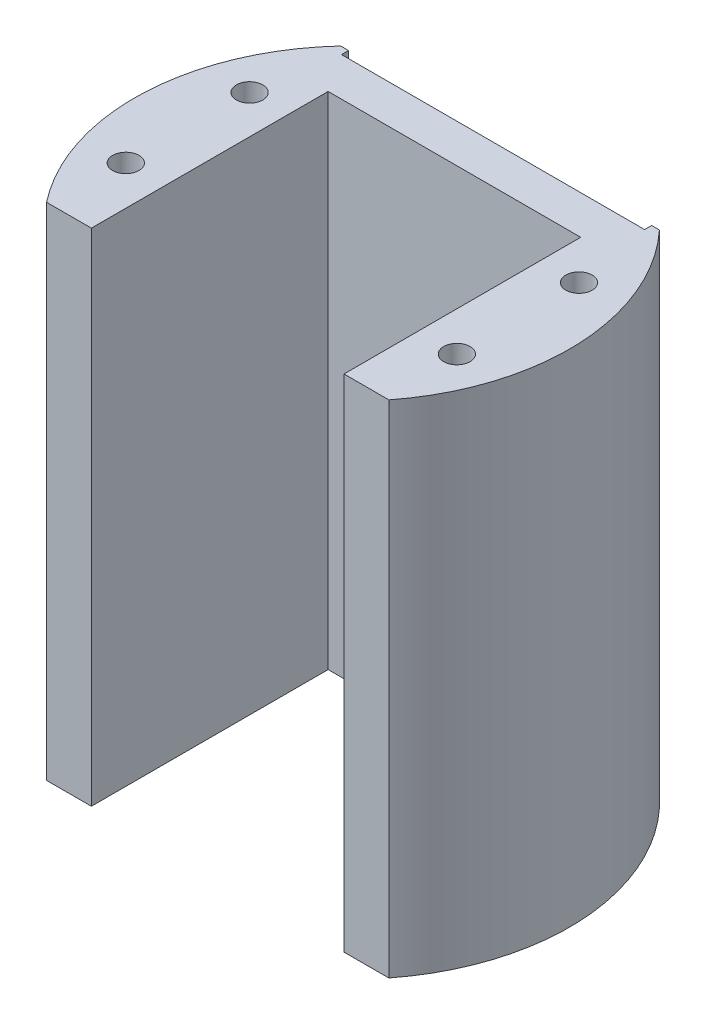
from build123d import *

# Parameters (mm, degrees)
SKETCH1_R           = 3
BOSS_EXTRUDE2_DEPTH = 114


with BuildPart() as part:
    # Sketch1 → Boss-Extrude2 (new body)
    with BuildSketch(Plane(origin=(0, 0, 0), x_dir=(1, 0, 0), z_dir=(0, 1, 0))):
        with BuildLine():
            Line((-38.960872846, -30.582205399), (-28.757656934, -30.582205399))
            Line((-28.757656934, -30.582205399), (-28.757656934, 23.321119009))
            Line((-28.757656934, 23.321119009), (28.757656934, 23.321119009))
            Line((28.757656934, 23.321119009), (28.757656934, -30.582205399))
            Line((28.757656934, -30.582205399), (38.960872846, -30.582205399))
            ThreePointArc((38.960872846, -30.582205399), (46.813208243, -16.178517669), (49.53, 0))
            ThreePointArc((49.53, 0), (46.099349035, 18.112728082), (36.282638054, 33.716332479))
            Line((36.282638054, 33.716332479), (34.5, 33.716332479))
            Line((34.5, 33.716332479), (34.5, 32.116332479))
            Line((34.5, 32.116332479), (-34.5, 32.116332479))
            Line((-34.5, 32.116332479), (-34.5, 33.716332479))
            Line((-34.5, 33.716332479), (-36.282638054, 33.716332479))
            ThreePointArc((-36.282638054, 33.716332479), (-49.487088988, 2.061291716), (-38.960872846, -30.582205399))
        make_face()
        with Locations((-37.690112611, -13.812642955)):
            Circle(SKETCH1_R, mode=Mode.SUBTRACT)
        with Locations((37.690112611, -13.812642955)):
            Circle(SKETCH1_R, mode=Mode.SUBTRACT)
        with Locations((-37.5, 14.187357045)):
            Circle(SKETCH1_R, mode=Mode.SUBTRACT)
        with Locations((37.5, 14.187357045)):
            Circle(SKETCH1_R, mode=Mode.SUBTRACT)
    extrude(amount=BOSS_EXTRUDE2_DEPTH)


solid = part.part
